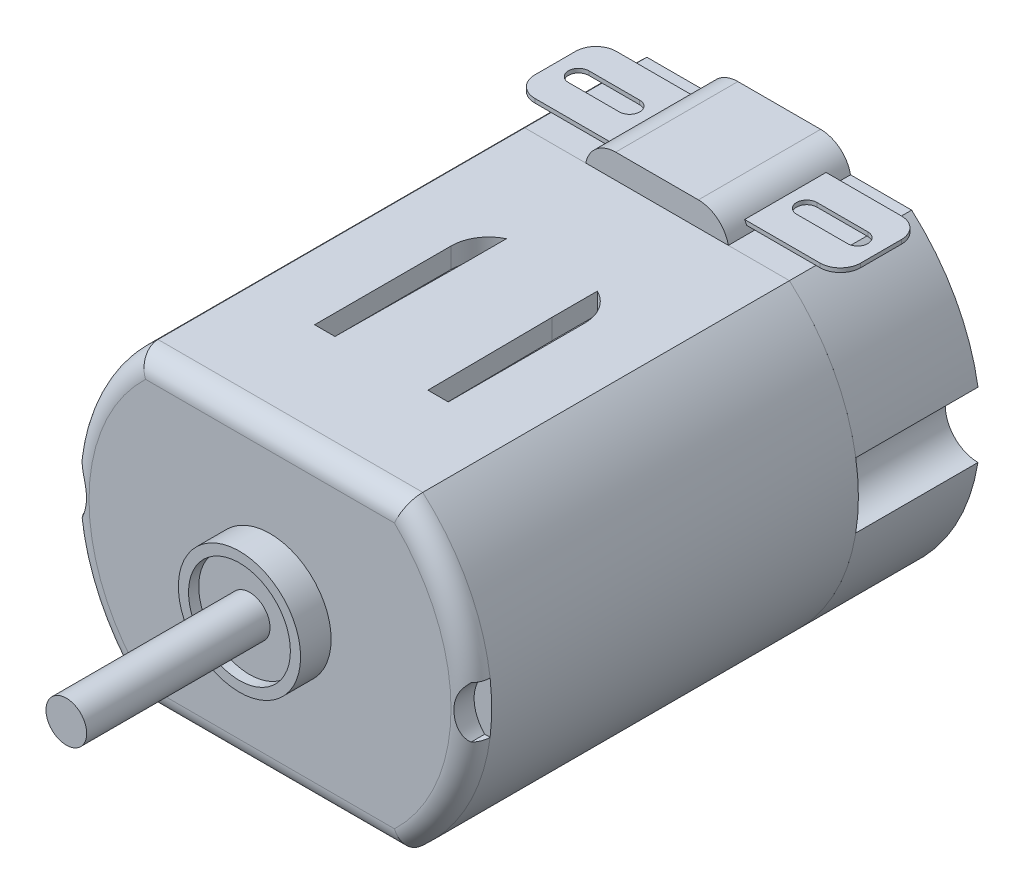
from build123d import *

# Parameters (mm, degrees)
Y_KSEKLIK_EKSTR_ZYON1_DEPTH      = 19
RADYUS1_R                        = 1
IZIM2_R                          = 3
Y_KSEKLIK_EKSTR_ZYON2_DEPTH      = 1.5
IZIM3_R                          = 2.5
KES_EKSTR_ZYON1_DEPTH            = 0.5
IZIM4_R                          = 1
Y_KSEKLIK_EKSTR_ZYON3_DEPTH      = 9
Y_KSEKLIK_EKSTR_ZYON4_DEPTH      = 6
KES_EKSTR_ZYON2_DEPTH            = 6
Y_KSEKLIK_EKSTR_ZYON5_DEPTH      = 2
Y_KSEKLIK_EKSTR_ZYON5_DEPTH_BACK = 2
IZIM7_R                          = 5
Y_KSEKLIK_EKSTR_ZYON6_START      = 1
IZIM8_R                          = 1
Y_KSEKLIK_EKSTR_ZYON6_DEPTH      = 1
KES_EKSTR_ZYON4_DEPTH            = 2
KES_EKSTR_ZYON5_DEPTH            = 2
IZIM11_W                         = 7
IZIM11_H                         = 1.2
Y_KSEKLIK_EKSTR_ZYON7_DEPTH      = 6
RADYUS6_R                        = 1.5
Y_KSEKLIK_EKSTR_ZYON9_DEPTH      = 8
Y_KSEKLIK_EKSTR_ZYON9_DEPTH_BACK = 8
IZIM14_W                         = 4
IZIM14_H                         = 0.199221602
KES_EKSTR_ZYON8_DEPTH            = 1
RADYUS8_R                        = 1
KES_EKSTR_ZYON9_DEPTH            = 1
KES_EKSTR_ZYON10_DEPTH           = 1


with BuildPart() as part:
    # Çizim1 → Yükseklik-Ekstrüzyon1 (new body)
    with BuildSketch(Plane.XY):
        with BuildLine():
            Line((-6.5, 7.5), (6.5, 7.5))
            ThreePointArc((6.5, 7.5), (9.885621722, 0), (6.5, -7.5))
            Line((6.5, -7.5), (-6.5, -7.5))
            ThreePointArc((-6.5, -7.5), (-9.885621722, 0), (-6.5, 7.5))
        make_face()
    extrude(amount=Y_KSEKLIK_EKSTR_ZYON1_DEPTH)

    # Radyus1
    radyus1_edges = [part.edges().sort_by_distance(p)[0] for p in [
        (9.885621722, 0, 19),
        (0, 7.5, 19),
        (-9.885621722, 0, 19),
        (0, -7.5, 19),
    ]]
    fillet(radyus1_edges, radius=RADYUS1_R)

    # Çizim2 → Yükseklik-Ekstrüzyon2 (add)
    with BuildSketch(Plane.XY.offset(19)):
        Circle(IZIM2_R)
    extrude(amount=Y_KSEKLIK_EKSTR_ZYON2_DEPTH)

    # Çizim3 → Kes-Ekstrüzyon1 (cut)
    with BuildSketch(Plane.XY.offset(20.5)):
        Circle(IZIM3_R)
    extrude(amount=-KES_EKSTR_ZYON1_DEPTH, mode=Mode.SUBTRACT)

    # Çizim4 → Yükseklik-Ekstrüzyon3 (add)
    with BuildSketch(Plane.XY.offset(20)):
        Circle(IZIM4_R)
    extrude(amount=Y_KSEKLIK_EKSTR_ZYON3_DEPTH)

    # Çizim16 → Kes-Ekstrüzyon9 (cut)
    with BuildSketch(Plane(origin=(0, 7.5, 0), x_dir=(1, 0, 0), z_dir=(0, 1, 0))):
        with BuildLine():
            Line((-3.281639929, -13.531109413), (-3.281639929, -6.83072225))
            ThreePointArc((-3.281639929, -6.83072225), (-2.996642201, -5.845727443), (-2.229713406, -5.165096342))
            Line((-2.229713406, -5.165096342), (-2.229713406, -7.39241151))
            Line((-2.229713406, -7.39241151), (-2.281639929, -13.531109413))
            Line((-2.281639929, -13.531109413), (-3.281639929, -13.531109413))
        make_face()
        with BuildLine():
            Line((2.281639929, -13.531109413), (3.281639929, -13.531109413))
            Line((3.281639929, -13.531109413), (3.281639929, -6.83072225))
            ThreePointArc((3.281639929, -6.83072225), (2.996642201, -5.845727443), (2.229713406, -5.165096342))
            Line((2.229713406, -5.165096342), (2.229713406, -7.39241151))
            Line((2.229713406, -7.39241151), (2.281639929, -13.531109413))
        make_face()
    extrude(amount=-KES_EKSTR_ZYON9_DEPTH, mode=Mode.SUBTRACT)

    # Çizim17 → Kes-Ekstrüzyon10 (cut)
    with BuildSketch(Plane.XY.offset(19)):
        with BuildLine():
            Line((-9.541715251, 1.262192915), (-10.236500342, 1.262192915))
            Line((-10.236500342, 1.262192915), (-10.236500342, -1.262192915))
            Line((-10.236500342, -1.262192915), (-9.541715251, -1.262192915))
            ThreePointArc((-9.541715251, -1.262192915), (-9.018897827, 0), (-9.541715251, 1.262192915))
        make_face()
        with BuildLine():
            Line((10.236500342, -1.262192915), (9.541715251, -1.262192915))
            ThreePointArc((9.541715251, -1.262192915), (9.018897827, 0), (9.541715251, 1.262192915))
            Line((9.541715251, 1.262192915), (10.236500342, 1.262192915))
            Line((10.236500342, 1.262192915), (10.236500342, -1.262192915))
        make_face()
    extrude(amount=-KES_EKSTR_ZYON10_DEPTH, mode=Mode.SUBTRACT)


with BuildPart() as body_2:
    # Çizim5 → Yükseklik-Ekstrüzyon4 (new body)
    with BuildSketch(Plane(origin=(0, 0, 0), x_dir=(-1, 0, 0), z_dir=(0, 0, -1))):
        with BuildLine():
            Line((-6.5, 7.5), (6.5, 7.5))
            ThreePointArc((6.5, 7.5), (9.885621722, 0), (6.5, -7.5))
            Line((6.5, -7.5), (-6.5, -7.5))
            ThreePointArc((-6.5, -7.5), (-9.885621722, 0), (-6.5, 7.5))
        make_face()
    extrude(amount=Y_KSEKLIK_EKSTR_ZYON4_DEPTH)

    # Çizim6 → Kes-Ekstrüzyon2 (cut)
    with BuildSketch(Plane(origin=(0, 0, -6), x_dir=(-1, 0, 0), z_dir=(0, 0, -1))):
        with BuildLine():
            ThreePointArc((-9.756792343, -1.599997058), (-8.153724068, 0), (-9.756792343, 1.599997058))
            ThreePointArc((-9.756792343, 1.599997058), (-9.885621722, 0), (-9.756792343, -1.599997058))
        make_face()
        with BuildLine():
            ThreePointArc((9.985548898, 1.599997058), (10.114378278, 0), (9.985548898, -1.599997058))
            ThreePointArc((9.985548898, -1.599997058), (8.382480624, 0), (9.985548898, 1.599997058))
        make_face()
    extrude(amount=-KES_EKSTR_ZYON2_DEPTH, mode=Mode.SUBTRACT)

    # Çizim7 → Yükseklik-Ekstrüzyon5 (add, two sides: drawn at the far end of the back side and taken through both)
    with BuildSketch(Plane(origin=(0, 0, -6), x_dir=(-1, 0, 0), z_dir=(0, 0, -1)).offset(-Y_KSEKLIK_EKSTR_ZYON5_DEPTH_BACK)):
        Circle(IZIM7_R)
    extrude(amount=Y_KSEKLIK_EKSTR_ZYON5_DEPTH + Y_KSEKLIK_EKSTR_ZYON5_DEPTH_BACK)

    # Çizim8 → Yükseklik-Ekstrüzyon6 (add)
    with BuildSketch(Plane(origin=(0, 0, -8), x_dir=(-1, 0, 0), z_dir=(0, 0, -1)).offset(Y_KSEKLIK_EKSTR_ZYON6_START)):
        Circle(IZIM8_R)
    extrude(amount=-Y_KSEKLIK_EKSTR_ZYON6_DEPTH)

    # Çizim10 → Kes-Ekstrüzyon4 (cut)
    with BuildSketch(Plane(origin=(0, 0, -8), x_dir=(-1, 0, 0), z_dir=(0, 0, -1))):
        with BuildLine():
            Line((-2.75, 2.6), (2.75, 2.6))
            ThreePointArc((2.75, 2.6), (3.15, 2.2), (2.75, 1.8))
            Line((2.75, 1.8), (-2.75, 1.8))
            ThreePointArc((-2.75, 1.8), (-3.15, 2.2), (-2.75, 2.6))
        make_face()
    extrude(amount=-KES_EKSTR_ZYON4_DEPTH, mode=Mode.SUBTRACT)

    # Çizim9 → Kes-Ekstrüzyon5 (cut)
    with BuildSketch(Plane(origin=(0, 0, -8), x_dir=(-1, 0, 0), z_dir=(0, 0, -1))):
        with BuildLine():
            Line((-3.570714214, 3.5), (3.570714214, 3.5))
            ThreePointArc((3.570714214, 3.5), (0, 5), (-3.570714214, 3.5))
        make_face()
    extrude(amount=-KES_EKSTR_ZYON5_DEPTH, mode=Mode.SUBTRACT)


with BuildPart() as body_3:
    # Çizim11 → Yükseklik-Ekstrüzyon7 (new body)
    with BuildSketch(Plane(origin=(0, 0, -6), x_dir=(-1, 0, 0), z_dir=(0, 0, -1))):
        with Locations((0, 8.1)):
            Rectangle(IZIM11_W, IZIM11_H)
    extrude(amount=-Y_KSEKLIK_EKSTR_ZYON7_DEPTH)

    # Radyus6
    # the kernel refuses this fillet: 1.5 mm, written as the material it takes off along each edge
    with BuildSketch(Plane(origin=(-3.5, 8.7, -9.674234614), x_dir=(1.5657845390625173e-12, -1.0, 0), z_dir=(0, 0, 1))) as radyus6_piece_1:
        with BuildLine():
            CenterArc((1.5, 1.469693846), RADYUS6_R, 180, 78.463040967)
            Line((0, 1.469693846), (-0.03, 1.469693846))
            Line((-0.03, 1.469693846), (-0.03, 0))
            Line((-0.03, 0), (0, -0.03))
            ThreePointArc((0, -0.03), (0.6, -0.03), (1.194, -0.029393877))
            Line((1.194, -0.029393877), (1.2, 0))
        make_face()
    extrude(amount=13.348469228, mode=Mode.SUBTRACT)
    with BuildSketch(Plane(origin=(3.5, 8.7, -9.674234614), x_dir=(-1, 0, 0), z_dir=(0, 0, 1))) as radyus6_piece_2:
        with BuildLine():
            CenterArc((1.469693846, 1.5), RADYUS6_R, 191.536959033, 78.463040967)
            Line((0, 1.2), (-0.029393877, 1.194))
            ThreePointArc((-0.029393877, 1.194), (-0.03, 0.6), (-0.03, 0))
            Line((-0.03, 0), (0, -0.03))
            Line((0, -0.03), (1.469693846, -0.03))
            Line((1.469693846, -0.03), (1.469693846, 0))
        make_face()
    extrude(amount=13.348469228, mode=Mode.SUBTRACT)

    # Çizim14 → Yükseklik-Ekstrüzyon9 (add, two sides: drawn at the far end of the back side and taken through both)
    with BuildSketch(Plane(origin=(0, 0, 0), x_dir=(0, 0, -1), z_dir=(1, 0, 0)).offset(-Y_KSEKLIK_EKSTR_ZYON9_DEPTH_BACK)):
        with Locations((3, 7.900389199)):
            Rectangle(IZIM14_W, IZIM14_H)
    extrude(amount=Y_KSEKLIK_EKSTR_ZYON9_DEPTH + Y_KSEKLIK_EKSTR_ZYON9_DEPTH_BACK)

    # Çizim15 → Kes-Ekstrüzyon8 (cut)
    with BuildSketch(Plane(origin=(0, 8.7, 0), x_dir=(1, 0, 0), z_dir=(0, 1, 0))):
        with BuildLine():
            Line((-6.849163908, 3.5), (-4.349163908, 3.5))
            ThreePointArc((-4.349163908, 3.5), (-3.849163908, 3), (-4.349163908, 2.5))
            Line((-4.349163908, 2.5), (-6.849163908, 2.5))
            ThreePointArc((-6.849163908, 2.5), (-7.349163908, 3), (-6.849163908, 3.5))
        make_face()
        with BuildLine():
            Line((6.849163908, 3.5), (4.349163908, 3.5))
            ThreePointArc((4.349163908, 3.5), (3.849163908, 3), (4.349163908, 2.5))
            Line((4.349163908, 2.5), (6.849163908, 2.5))
            ThreePointArc((6.849163908, 2.5), (7.349163908, 3), (6.849163908, 3.5))
        make_face()
    extrude(amount=-KES_EKSTR_ZYON8_DEPTH, mode=Mode.SUBTRACT)

    # Radyus8
    radyus8_edges = [body_3.edges().sort_by_distance(p)[0] for p in [
        (-8, 7.900389199, -1),
        (-8, 7.900389199, -5),
        (8, 7.900389199, -1),
        (8, 7.900389199, -5),
    ]]
    fillet(radyus8_edges, radius=RADYUS8_R)


solid = Compound([part.part, body_2.part, body_3.part])
